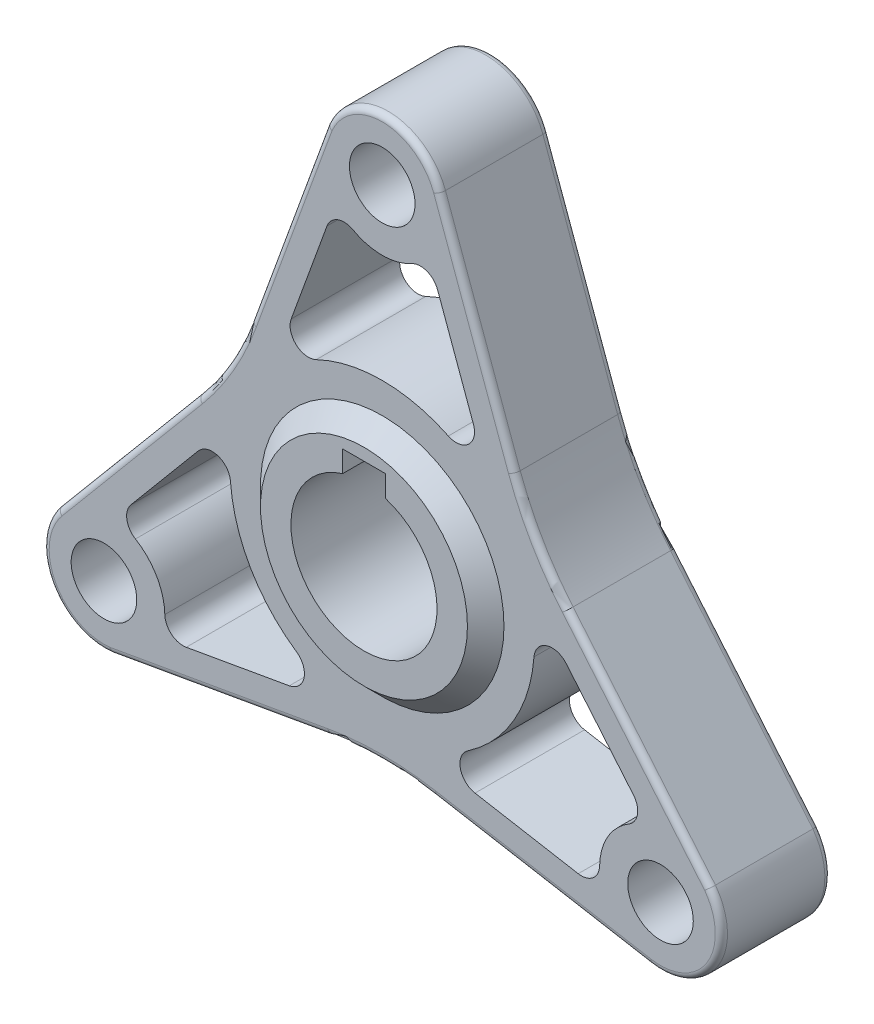
from build123d import *

# Parameters (mm, degrees)
SKETCH_1_R               = 5.386267440115599
SKETCH_1_R_2             = 5.386267440115426
SKETCH_1_R_3             = 20
SKETCH_1_R_4             = 5.3862674401151445
EXTRUDE_1_DEPTH          = 9
SKETCH_1_3_R             = 20
EXTRUDE_2_DEPTH          = 12
CUT_EXTRUDE_1_DEPTH      = 85.79389650309288
CUT_EXTRUDE_1_DEPTH_BACK = 85.79389650309288
CHAMFER_1_SIZE           = 3
FILLET_7_R               = 1
FILLET_9_R               = 1


# Some blends are built 0.0001 mm under size
with BuildPart() as part:
    # 스케치1 → 보스-돌출1 (new, symmetric)
    # profile 1 of 2: a face of its own
    with BuildSketch(Plane.XY):
        with BuildLine():
            ThreePointArc((-30.30353233995049, 7.529430557445876), (-25.30448430667716, 14.66881104177321), (-21.621123456603517, 22.56780387549022))
            Line((-21.621123456603517, 22.56780387549022), (-9.176064809943858, 56.760321490976835))
            ThreePointArc((-9.176064809943858, 56.760321490976835), (0.29852591934797246, 62.780964033722356), (9.396926207859103, 56.20562234639382))
            Line((9.396926207859103, 56.20562234639382), (21.67244430875402, 22.47891355207783))
            ThreePointArc((21.67244430875402, 22.47891355207783), (25.355805158827664, 14.579920718360814), (30.354853192101004, 7.440540234033471))
            Line((30.354853192101004, 7.440540234033471), (53.7439127431297, -20.433455513304605))
            ThreePointArc((53.7439127431297, -20.433455513304605), (54.22064676760672, -31.649013046704578), (43.97703368356183, -36.240787986690655))
            Line((43.97703368356183, -36.240787986690655), (8.631088031196274, -30.00834410952336))
            ThreePointArc((8.631088031196274, -30.00834410952336), (-0.0513208521507147, -29.248731760133694), (-8.733729735497715, -30.008344109523378))
            Line((-8.733729735497715, -30.008344109523378), (-44.56784793318583, -36.32686597767225))
            ThreePointArc((-44.56784793318583, -36.32686597767225), (-54.51917268695475, -31.131950987017753), (-53.37395989142093, -19.964834359703186))
            Line((-53.37395989142093, -19.964834359703186), (-30.30353233995049, 7.529430557445876))
        make_face()
        with Locations((-45.7135154602312, -26.392710456568583)):
            Circle(SKETCH_1_R, mode=Mode.SUBTRACT)
        with Locations((45.71351546023121, -26.392710456568555)):
            Circle(SKETCH_1_R_2, mode=Mode.SUBTRACT)
        Circle(SKETCH_1_R_3, mode=Mode.SUBTRACT)
        with Locations((0, 52.78542091313719)):
            Circle(SKETCH_1_R_4, mode=Mode.SUBTRACT)
        with BuildLine():
            ThreePointArc((-24.93099104661169, -1.856255756561672), (-27.002088749126838, 0.7762442533106575), (-30.22084330156199, -0.1506436182894203))
            Line((-30.22084330156199, -0.1506436182894203), (-41.28698133071818, -13.338753370678669))
            ThreePointArc((-41.28698133071818, -13.338753370678669), (-41.94835091243124, -15.758382440557112), (-40.54069433802355, -17.834561028237598))
            ThreePointArc((-40.54069433802355, -17.834561028237598), (-37.056732035085815, -21.386703991318203), (-35.71581818831214, -26.17811954561789))
            ThreePointArc((-35.71581818831214, -26.17811954561789), (-34.620101474352836, -28.43243494649932), (-32.19556447373562, -29.068165531369296))
            Line((-32.19556447373562, -29.068165531369296), (-15.261974751472668, -26.082316783086657))
            ThreePointArc((-15.261974751472668, -26.082316783086657), (-12.850176674158359, -23.759574441635834), (-14.091892218279895, -20.64990493218754))
            ThreePointArc((-14.091892218279895, -20.64990493218754), (-21.656330873683668, -12.49012942645256), (-24.93099104661169, -1.856255756561672))
        make_face(mode=Mode.SUBTRACT)
        with BuildLine():
            ThreePointArc((14.073060164409453, -20.662743709607216), (12.828797131654818, -23.77261693864109), (15.240882851137762, -26.096696213796697))
            Line((15.240882851137762, -26.096696213796697), (32.19518993918212, -29.086197992636468))
            ThreePointArc((32.19518993918212, -29.086197992636468), (34.6213349722887, -28.44914631675104), (35.71553008480945, -26.19199066966955))
            ThreePointArc((35.71553008480945, -26.19199066966955), (37.049794977242556, -21.39871932795785), (40.5288256439671, -17.841746095215687))
            ThreePointArc((40.5288256439671, -17.841746095215687), (41.93326169229327, -15.765669885135), (41.2715520284448, -13.34809395775018))
            Line((41.2715520284448, -13.34809395775018), (30.2189362994426, -0.1760994551487046))
            ThreePointArc((30.2189362994426, -0.1760994551487046), (27.001483386643283, 0.7512077778785407), (24.929288366147933, -1.8789841823288744))
            ThreePointArc((24.929288366147933, -1.8789841823288744), (21.644934816705337, -12.509867976144985), (14.073060164409453, -20.662743709607216))
        make_face(mode=Mode.SUBTRACT)
        with BuildLine():
            ThreePointArc((-4.813007455654948, 44.019865640833565), (-7.313160217940428, 44.19810483163431), (-9.075987554709165, 42.41625948911946))
            Line((-9.075987554709165, 42.41625948911946), (-14.95696154796992, 26.258416238235363))
            ThreePointArc((-14.95696154796992, 26.258416238235363), (-14.151306712484917, 23.008366663757286), (-10.837396147868024, 22.528889114516407))
            ThreePointArc((-10.837396147868024, 22.528889114516407), (0.01139605697825839, 24.999997402597582), (10.857930882202126, 22.51899946616905))
            ThreePointArc((10.857930882202126, 22.51899946616905), (14.17329161747192, 22.99637268533062), (14.979960450424109, 26.247339832086322))
            Line((14.979960450424109, 26.247339832086322), (9.091791391536077, 42.42495136331512))
            ThreePointArc((9.091791391536077, 42.42495136331512), (7.327015940142559, 44.20752875730815), (4.825164253214109, 44.02655169790714))
            ThreePointArc((4.825164253214109, 44.02655169790714), (0.00693705784330613, 42.785423319276056), (-4.813007455654948, 44.019865640833565))
        make_face(mode=Mode.SUBTRACT)
    # profile 2 of 2: a face of its own
    with BuildSketch(Plane.XY):
        Circle(SKETCH_1_R_3)
    extrude(amount=EXTRUDE_1_DEPTH, both=True)

    # 스케치1<3> → 보스-돌출2 (add, symmetric)
    with BuildSketch(Plane.XY):
        Circle(SKETCH_1_3_R)
    extrude(amount=EXTRUDE_2_DEPTH, both=True)

    # 스케치2 → 컷-돌출1 (cut, two sides: drawn at the far end of the back side and taken through both)
    with BuildSketch(Plane.XY.offset(-CUT_EXTRUDE_1_DEPTH_BACK)):
        with BuildLine():
            Line((-3.5000000000000018, 14.999999999999998), (3.4999999999999982, 14.999999999999998))
            Line((3.4999999999999982, 14.999999999999998), (3.4999999999999987, 11.478240283248999))
            ThreePointArc((3.4999999999999987, 11.478240283248999), (-2.2e-15, -12.000000000000004), (-3.5000000000000013, 11.478240283248999))
            Line((-3.5000000000000013, 11.478240283248999), (-3.5000000000000018, 14.999999999999998))
        make_face()
    extrude(amount=CUT_EXTRUDE_1_DEPTH + CUT_EXTRUDE_1_DEPTH_BACK, mode=Mode.SUBTRACT)

    # 모따기1
    chamfer_1_edges = [part.edges().sort_by_distance(p)[0] for p in [
        (-20, 2.45e-15, -12),
        (-20, 2.45e-15, 12),
    ]]
    chamfer(chamfer_1_edges, length=CHAMFER_1_SIZE - 0.0001)  # a hair under: the kernel refuses the full size

    # 필렛7
    # the kernel refuses this fillet: 1 mm, written as the material it takes off along each edge
    with BuildSketch(Plane(origin=(-21.621123456603517, 22.56780387549022, -9), x_dir=(0.9396926207859106, -0.34202014332566255, 0), z_dir=(0.34202014332566255, 0.9396926207859106, 0))) as fillet_7_piece_1:
        with BuildLine():
            CenterArc((FILLET_7_R, -FILLET_7_R), FILLET_7_R, 90, 90)
            Line((0, -FILLET_7_R), (-FILLET_7_R * 0.02, -FILLET_7_R))
            Line((-FILLET_7_R * 0.02, -FILLET_7_R), (-FILLET_7_R * 0.02, FILLET_7_R * 0.02))
            Line((-FILLET_7_R * 0.02, FILLET_7_R * 0.02), (FILLET_7_R, FILLET_7_R * 0.02))
            Line((FILLET_7_R, FILLET_7_R * 0.02), (FILLET_7_R, 0))
        make_face()
    extrude(amount=37.386917231391855, mode=Mode.SUBTRACT)
    with BuildSketch(Plane(origin=(8.9e-16, 52.78542091313719, -9), x_dir=(-0.952733181074785, 0.30380830416418975, 0), z_dir=(-0.30380830416418975, -0.952733181074785, 0))) as fillet_7_piece_2:
        with BuildLine():
            CenterArc((9.999999999999998 - FILLET_7_R, -FILLET_7_R), FILLET_7_R, 0, 90)
            Line((10, -FILLET_7_R), (9.999999999999998 + FILLET_7_R * 0.02, -FILLET_7_R))
            Line((9.999999999999998 + FILLET_7_R * 0.02, -FILLET_7_R), (9.999999999999998 + FILLET_7_R * 0.02, FILLET_7_R * 0.02))
            Line((9.999999999999998 + FILLET_7_R * 0.02, FILLET_7_R * 0.02), (9.999999999999998 - FILLET_7_R, FILLET_7_R * 0.02))
            Line((9.999999999999998 - FILLET_7_R, FILLET_7_R * 0.02), (9.999999999999998 - FILLET_7_R, 0))
        make_face()
    revolve(axis=Axis((8.9e-16, 52.78542091313719, -9), (0, 0, -1)), revolution_arc=142.31351700415118, mode=Mode.SUBTRACT)
    with BuildSketch(Plane(origin=(9.396926207859103, 56.20562234639382, -9), x_dir=(-0.9396926207859108, -0.3420201433256624, 0), z_dir=(0.3420201433256624, -0.9396926207859108, 0))) as fillet_7_piece_3:
        with BuildLine():
            CenterArc((FILLET_7_R, -FILLET_7_R), FILLET_7_R, 90, 90)
            Line((0, -FILLET_7_R), (-FILLET_7_R * 0.02, -FILLET_7_R))
            Line((-FILLET_7_R * 0.02, -FILLET_7_R), (-FILLET_7_R * 0.02, FILLET_7_R * 0.02))
            Line((-FILLET_7_R * 0.02, FILLET_7_R * 0.02), (FILLET_7_R, FILLET_7_R * 0.02))
            Line((FILLET_7_R, FILLET_7_R * 0.02), (FILLET_7_R, 0))
        make_face()
    extrude(amount=35.891213837678855, mode=Mode.SUBTRACT)
    with BuildSketch(Plane(origin=(68.65707534805, 39.57992071836101, -9), x_dir=(-0.9396926207859114, -0.3420201433256606, 0), z_dir=(-0.3420201433256606, 0.9396926207859114, 0))) as fillet_7_piece_4:
        with BuildLine():
            CenterArc((50.00000000000044 + FILLET_7_R, FILLET_7_R), FILLET_7_R, 180, 90)
            Line((50.00000000000044, FILLET_7_R), (50.00000000000044 - FILLET_7_R * 0.02, FILLET_7_R))
            Line((50.00000000000044 - FILLET_7_R * 0.02, FILLET_7_R), (50.00000000000044 - FILLET_7_R * 0.02, -FILLET_7_R * 0.02))
            Line((50.00000000000044 - FILLET_7_R * 0.02, -FILLET_7_R * 0.02), (50.00000000000044 + FILLET_7_R, -FILLET_7_R * 0.02))
            Line((50.00000000000044 + FILLET_7_R, -FILLET_7_R * 0.02), (50.00000000000044 + FILLET_7_R, 0))
        make_face()
    revolve(axis=Axis((68.65707534805, 39.57992071836101, -9), (0, 0, 1)), revolution_arc=20.000000000000934, mode=Mode.SUBTRACT)
    with BuildSketch(Plane(origin=(30.354853192101004, 7.440540234033471, -9), x_dir=(-0.7660444431189747, -0.6427876096865432, 0), z_dir=(0.6427876096865434, -0.7660444431189748, 0))) as fillet_7_piece_5:
        with BuildLine():
            CenterArc((FILLET_7_R, -FILLET_7_R), FILLET_7_R, 90, 90)
            Line((0, -FILLET_7_R), (-FILLET_7_R * 0.02, -FILLET_7_R))
            Line((-FILLET_7_R * 0.02, -FILLET_7_R), (-FILLET_7_R * 0.02, FILLET_7_R * 0.02))
            Line((-FILLET_7_R * 0.02, FILLET_7_R * 0.02), (FILLET_7_R, FILLET_7_R * 0.02))
            Line((FILLET_7_R, FILLET_7_R * 0.02), (FILLET_7_R, 0))
        make_face()
    extrude(amount=37.386917231392225, mode=Mode.SUBTRACT)
    with BuildSketch(Plane(origin=(45.71351546023114, -26.392710456568558, -9), x_dir=(0.7394722998242538, 0.673186985757025, 0), z_dir=(-0.673186985757025, 0.7394722998242538, 0))) as fillet_7_piece_6:
        with BuildLine():
            CenterArc((10.000000000000018 - FILLET_7_R, -FILLET_7_R), FILLET_7_R, 0, 90)
            Line((10.000000000000018, -FILLET_7_R), (10.000000000000018 + FILLET_7_R * 0.02, -FILLET_7_R))
            Line((10.000000000000018 + FILLET_7_R * 0.02, -FILLET_7_R), (10.000000000000018 + FILLET_7_R * 0.02, FILLET_7_R * 0.02))
            Line((10.000000000000018 + FILLET_7_R * 0.02, FILLET_7_R * 0.02), (10.000000000000018 - FILLET_7_R, FILLET_7_R * 0.02))
            Line((10.000000000000018 - FILLET_7_R, FILLET_7_R * 0.02), (10.000000000000018 - FILLET_7_R, 0))
        make_face()
    revolve(axis=Axis((45.71351546023114, -26.392710456568558, -9), (0, 0, -1)), revolution_arc=142.31351700415058, mode=Mode.SUBTRACT)
    with BuildSketch(Plane(origin=(43.97703368356183, -36.240787986690655, -9), x_dir=(0.17364817766693527, 0.9848077530122072, 0), z_dir=(-0.9848077530122072, 0.17364817766693527, 0))) as fillet_7_piece_7:
        with BuildLine():
            CenterArc((FILLET_7_R, -FILLET_7_R), FILLET_7_R, 90, 90)
            Line((0, -FILLET_7_R), (-FILLET_7_R * 0.02, -FILLET_7_R))
            Line((-FILLET_7_R * 0.02, -FILLET_7_R), (-FILLET_7_R * 0.02, FILLET_7_R * 0.02))
            Line((-FILLET_7_R * 0.02, FILLET_7_R * 0.02), (FILLET_7_R, FILLET_7_R * 0.02))
            Line((FILLET_7_R, FILLET_7_R * 0.02), (FILLET_7_R, 0))
        make_face()
    extrude(amount=35.89121383767927, mode=Mode.SUBTRACT)
    with BuildSketch(Plane(origin=(-0.05132085215066962, -79.24873176013405, -9), x_dir=(0.1736481776669377, 0.9848077530122067, 0), z_dir=(0.9848077530122067, -0.1736481776669377, 0))) as fillet_7_piece_8:
        with BuildLine():
            CenterArc((50.00000000000036 + FILLET_7_R, FILLET_7_R), FILLET_7_R, 180, 90)
            Line((50.00000000000036, FILLET_7_R), (50.00000000000036 - FILLET_7_R * 0.02, FILLET_7_R))
            Line((50.00000000000036 - FILLET_7_R * 0.02, FILLET_7_R), (50.00000000000036 - FILLET_7_R * 0.02, -FILLET_7_R * 0.02))
            Line((50.00000000000036 - FILLET_7_R * 0.02, -FILLET_7_R * 0.02), (50.00000000000036 + FILLET_7_R, -FILLET_7_R * 0.02))
            Line((50.00000000000036 + FILLET_7_R, -FILLET_7_R * 0.02), (50.00000000000036 + FILLET_7_R, 0))
        make_face()
    revolve(axis=Axis((-0.05132085215066962, -79.24873176013405, -9), (0, 0, 1)), revolution_arc=20.00000000000097, mode=Mode.SUBTRACT)
    with BuildSketch(Plane(origin=(-8.733729735497715, -30.008344109523378, -9), x_dir=(-0.17364817766693744, 0.9848077530122069, 0), z_dir=(-0.9848077530122069, -0.17364817766693744, 0))) as fillet_7_piece_9:
        with BuildLine():
            CenterArc((FILLET_7_R, -FILLET_7_R), FILLET_7_R, 90, 90)
            Line((0, -FILLET_7_R), (-FILLET_7_R * 0.02, -FILLET_7_R))
            Line((-FILLET_7_R * 0.02, -FILLET_7_R), (-FILLET_7_R * 0.02, FILLET_7_R * 0.02))
            Line((-FILLET_7_R * 0.02, FILLET_7_R * 0.02), (FILLET_7_R, FILLET_7_R * 0.02))
            Line((FILLET_7_R, FILLET_7_R * 0.02), (FILLET_7_R, 0))
        make_face()
    extrude(amount=37.38691723139181, mode=Mode.SUBTRACT)
    with BuildSketch(Plane(origin=(-45.713515460231235, -26.392710456568643, -9), x_dir=(0.21326088125054068, -0.9769952899212169, 0), z_dir=(0.9769952899212169, 0.21326088125054068, 0))) as fillet_7_piece_10:
        with BuildLine():
            CenterArc((9.999999999999979 - FILLET_7_R, -FILLET_7_R), FILLET_7_R, 0, 90)
            Line((9.999999999999973, -FILLET_7_R), (9.999999999999979 + FILLET_7_R * 0.02, -FILLET_7_R))
            Line((9.999999999999979 + FILLET_7_R * 0.02, -FILLET_7_R), (9.999999999999979 + FILLET_7_R * 0.02, FILLET_7_R * 0.02))
            Line((9.999999999999979 + FILLET_7_R * 0.02, FILLET_7_R * 0.02), (9.999999999999979 - FILLET_7_R, FILLET_7_R * 0.02))
            Line((9.999999999999979 - FILLET_7_R, FILLET_7_R * 0.02), (9.999999999999979 - FILLET_7_R, 0))
        make_face()
    revolve(axis=Axis((-45.713515460231235, -26.392710456568643, -9), (0, 0, -1)), revolution_arc=142.31351700415175, mode=Mode.SUBTRACT)
    with BuildSketch(Plane(origin=(-53.37395989142093, -19.964834359703186, -9), x_dir=(0.7660444431189748, -0.6427876096865431, 0), z_dir=(0.6427876096865432, 0.7660444431189749, 0))) as fillet_7_piece_11:
        with BuildLine():
            CenterArc((FILLET_7_R, -FILLET_7_R), FILLET_7_R, 90, 90)
            Line((0, -FILLET_7_R), (-FILLET_7_R * 0.02, -FILLET_7_R))
            Line((-FILLET_7_R * 0.02, -FILLET_7_R), (-FILLET_7_R * 0.02, FILLET_7_R * 0.02))
            Line((-FILLET_7_R * 0.02, FILLET_7_R * 0.02), (FILLET_7_R, FILLET_7_R * 0.02))
            Line((FILLET_7_R, FILLET_7_R * 0.02), (FILLET_7_R, 0))
        make_face()
    extrude(amount=35.89121383767928, mode=Mode.SUBTRACT)
    with BuildSketch(Plane(origin=(-68.60575449589972, 39.66881104177352, -9), x_dir=(0.766044443118974, -0.6427876096865442, 0), z_dir=(-0.6427876096865442, -0.766044443118974, 0))) as fillet_7_piece_12:
        with BuildLine():
            CenterArc((50.000000000000696 + FILLET_7_R, FILLET_7_R), FILLET_7_R, 180, 90)
            Line((50.000000000000696, FILLET_7_R), (50.000000000000696 - FILLET_7_R * 0.02, FILLET_7_R))
            Line((50.000000000000696 - FILLET_7_R * 0.02, FILLET_7_R), (50.000000000000696 - FILLET_7_R * 0.02, -FILLET_7_R * 0.02))
            Line((50.000000000000696 - FILLET_7_R * 0.02, -FILLET_7_R * 0.02), (50.000000000000696 + FILLET_7_R, -FILLET_7_R * 0.02))
            Line((50.000000000000696 + FILLET_7_R, -FILLET_7_R * 0.02), (50.000000000000696 + FILLET_7_R, 0))
        make_face()
    revolve(axis=Axis((-68.60575449589972, 39.66881104177352, -9), (0, 0, 1)), revolution_arc=20.00000000000081, mode=Mode.SUBTRACT)

    # 필렛9
    # the kernel refuses this fillet: 1 mm, written as the material it takes off along each edge
    with BuildSketch(Plane(origin=(-68.60575449589972, 39.66881104177352, 9), x_dir=(0.766044443118974, -0.6427876096865442, 0), z_dir=(-0.6427876096865442, -0.766044443118974, 0))) as fillet_9_piece_1:
        with BuildLine():
            CenterArc((50.000000000000696 + FILLET_9_R, -FILLET_9_R), FILLET_9_R, 90, 90)
            Line((50.000000000000696 + FILLET_9_R, 0), (50.000000000000696 + FILLET_9_R, FILLET_9_R * 0.02))
            Line((50.000000000000696 + FILLET_9_R, FILLET_9_R * 0.02), (50.000000000000696 - FILLET_9_R * 0.02, FILLET_9_R * 0.02))
            Line((50.000000000000696 - FILLET_9_R * 0.02, FILLET_9_R * 0.02), (50.000000000000696 - FILLET_9_R * 0.02, -FILLET_9_R))
            Line((50.000000000000696 - FILLET_9_R * 0.02, -FILLET_9_R), (50.000000000000696, -FILLET_9_R))
        make_face()
    revolve(axis=Axis((-68.60575449589972, 39.66881104177352, 9), (0, 0, 1)), revolution_arc=20.00000000000081, mode=Mode.SUBTRACT)
    with BuildSketch(Plane(origin=(-53.37395989142093, -19.964834359703186, 9), x_dir=(0, 0, -1), z_dir=(0.6427876096865432, 0.7660444431189749, 0))) as fillet_9_piece_2:
        with BuildLine():
            CenterArc((FILLET_9_R, -FILLET_9_R), FILLET_9_R, 90, 90)
            Line((0, -FILLET_9_R), (-FILLET_9_R * 0.02, -FILLET_9_R))
            Line((-FILLET_9_R * 0.02, -FILLET_9_R), (-FILLET_9_R * 0.02, FILLET_9_R * 0.02))
            Line((-FILLET_9_R * 0.02, FILLET_9_R * 0.02), (FILLET_9_R, FILLET_9_R * 0.02))
            Line((FILLET_9_R, FILLET_9_R * 0.02), (FILLET_9_R, 0))
        make_face()
    extrude(amount=35.89121383767928, mode=Mode.SUBTRACT)
    with BuildSketch(Plane(origin=(-45.713515460231235, -26.392710456568643, 9), x_dir=(0.21326088125054068, -0.9769952899212169, 0), z_dir=(0.9769952899212169, 0.21326088125054068, 0))) as fillet_9_piece_3:
        with BuildLine():
            CenterArc((9.999999999999979 - FILLET_9_R, FILLET_9_R), FILLET_9_R, 270.00000000000034, 89.99999999999966)
            Line((9.999999999999979 - FILLET_9_R, 0), (9.999999999999979 - FILLET_9_R, -FILLET_9_R * 0.02))
            Line((9.999999999999979 - FILLET_9_R, -FILLET_9_R * 0.02), (9.999999999999979 + FILLET_9_R * 0.02, -FILLET_9_R * 0.02))
            Line((9.999999999999979 + FILLET_9_R * 0.02, -FILLET_9_R * 0.02), (9.999999999999979 + FILLET_9_R * 0.02, FILLET_9_R))
            Line((9.999999999999979 + FILLET_9_R * 0.02, FILLET_9_R), (9.999999999999973, FILLET_9_R))
        make_face()
    revolve(axis=Axis((-45.713515460231235, -26.392710456568643, 9), (0, 0, -1)), revolution_arc=142.31351700415175, mode=Mode.SUBTRACT)
    with BuildSketch(Plane(origin=(-8.733729735497715, -30.008344109523378, 9), x_dir=(0, 0, -1), z_dir=(-0.9848077530122069, -0.17364817766693744, 0))) as fillet_9_piece_4:
        with BuildLine():
            CenterArc((FILLET_9_R, -FILLET_9_R), FILLET_9_R, 90, 90)
            Line((0, -FILLET_9_R), (-FILLET_9_R * 0.02, -FILLET_9_R))
            Line((-FILLET_9_R * 0.02, -FILLET_9_R), (-FILLET_9_R * 0.02, FILLET_9_R * 0.02))
            Line((-FILLET_9_R * 0.02, FILLET_9_R * 0.02), (FILLET_9_R, FILLET_9_R * 0.02))
            Line((FILLET_9_R, FILLET_9_R * 0.02), (FILLET_9_R, 0))
        make_face()
    extrude(amount=37.38691723139181, mode=Mode.SUBTRACT)
    with BuildSketch(Plane(origin=(-0.05132085215066962, -79.24873176013405, 9), x_dir=(0.1736481776669377, 0.9848077530122067, 0), z_dir=(0.9848077530122067, -0.1736481776669377, 0))) as fillet_9_piece_5:
        with BuildLine():
            CenterArc((50.00000000000036 + FILLET_9_R, -FILLET_9_R), FILLET_9_R, 90, 90)
            Line((50.00000000000036 + FILLET_9_R, 0), (50.00000000000036 + FILLET_9_R, FILLET_9_R * 0.02))
            Line((50.00000000000036 + FILLET_9_R, FILLET_9_R * 0.02), (50.00000000000036 - FILLET_9_R * 0.02, FILLET_9_R * 0.02))
            Line((50.00000000000036 - FILLET_9_R * 0.02, FILLET_9_R * 0.02), (50.00000000000036 - FILLET_9_R * 0.02, -FILLET_9_R))
            Line((50.00000000000036 - FILLET_9_R * 0.02, -FILLET_9_R), (50.00000000000036, -FILLET_9_R))
        make_face()
    revolve(axis=Axis((-0.05132085215066962, -79.24873176013405, 9), (0, 0, 1)), revolution_arc=20.00000000000097, mode=Mode.SUBTRACT)
    with BuildSketch(Plane(origin=(43.97703368356183, -36.240787986690655, 9), x_dir=(0, 0, -1), z_dir=(-0.9848077530122072, 0.17364817766693527, 0))) as fillet_9_piece_6:
        with BuildLine():
            CenterArc((FILLET_9_R, -FILLET_9_R), FILLET_9_R, 90, 90)
            Line((0, -FILLET_9_R), (-FILLET_9_R * 0.02, -FILLET_9_R))
            Line((-FILLET_9_R * 0.02, -FILLET_9_R), (-FILLET_9_R * 0.02, FILLET_9_R * 0.02))
            Line((-FILLET_9_R * 0.02, FILLET_9_R * 0.02), (FILLET_9_R, FILLET_9_R * 0.02))
            Line((FILLET_9_R, FILLET_9_R * 0.02), (FILLET_9_R, 0))
        make_face()
    extrude(amount=35.89121383767927, mode=Mode.SUBTRACT)
    with BuildSketch(Plane(origin=(45.71351546023114, -26.392710456568558, 9), x_dir=(0.7394722998242538, 0.673186985757025, 0), z_dir=(-0.673186985757025, 0.7394722998242538, 0))) as fillet_9_piece_7:
        with BuildLine():
            CenterArc((10.000000000000016 - FILLET_9_R, FILLET_9_R), FILLET_9_R, 269.9999999999998, 90.00000000000023)
            Line((10.000000000000016 - FILLET_9_R, 0), (10.000000000000016 - FILLET_9_R, -FILLET_9_R * 0.02))
            Line((10.000000000000016 - FILLET_9_R, -FILLET_9_R * 0.02), (10.000000000000016 + FILLET_9_R * 0.02, -FILLET_9_R * 0.02))
            Line((10.000000000000016 + FILLET_9_R * 0.02, -FILLET_9_R * 0.02), (10.000000000000016 + FILLET_9_R * 0.02, FILLET_9_R))
            Line((10.000000000000016 + FILLET_9_R * 0.02, FILLET_9_R), (10.000000000000018, FILLET_9_R))
        make_face()
    revolve(axis=Axis((45.71351546023114, -26.392710456568558, 9), (0, 0, -1)), revolution_arc=142.31351700415058, mode=Mode.SUBTRACT)
    with BuildSketch(Plane(origin=(30.354853192101004, 7.440540234033471, 9), x_dir=(0, 0, -1), z_dir=(0.6427876096865434, -0.7660444431189748, 0))) as fillet_9_piece_8:
        with BuildLine():
            CenterArc((FILLET_9_R, -FILLET_9_R), FILLET_9_R, 90, 90)
            Line((0, -FILLET_9_R), (-FILLET_9_R * 0.02, -FILLET_9_R))
            Line((-FILLET_9_R * 0.02, -FILLET_9_R), (-FILLET_9_R * 0.02, FILLET_9_R * 0.02))
            Line((-FILLET_9_R * 0.02, FILLET_9_R * 0.02), (FILLET_9_R, FILLET_9_R * 0.02))
            Line((FILLET_9_R, FILLET_9_R * 0.02), (FILLET_9_R, 0))
        make_face()
    extrude(amount=37.386917231392225, mode=Mode.SUBTRACT)
    with BuildSketch(Plane(origin=(68.65707534805, 39.57992071836101, 9), x_dir=(-0.9396926207859114, -0.3420201433256606, 0), z_dir=(-0.3420201433256606, 0.9396926207859114, 0))) as fillet_9_piece_9:
        with BuildLine():
            CenterArc((50.00000000000044 + FILLET_9_R, -FILLET_9_R), FILLET_9_R, 90, 90)
            Line((50.00000000000044 + FILLET_9_R, 0), (50.00000000000044 + FILLET_9_R, FILLET_9_R * 0.02))
            Line((50.00000000000044 + FILLET_9_R, FILLET_9_R * 0.02), (50.00000000000044 - FILLET_9_R * 0.02, FILLET_9_R * 0.02))
            Line((50.00000000000044 - FILLET_9_R * 0.02, FILLET_9_R * 0.02), (50.00000000000044 - FILLET_9_R * 0.02, -FILLET_9_R))
            Line((50.00000000000044 - FILLET_9_R * 0.02, -FILLET_9_R), (50.00000000000044, -FILLET_9_R))
        make_face()
    revolve(axis=Axis((68.65707534805, 39.57992071836101, 9), (0, 0, 1)), revolution_arc=20.000000000000934, mode=Mode.SUBTRACT)
    with BuildSketch(Plane(origin=(9.396926207859103, 56.20562234639382, 9), x_dir=(0, 0, -1), z_dir=(0.3420201433256624, -0.9396926207859108, 0))) as fillet_9_piece_10:
        with BuildLine():
            CenterArc((FILLET_9_R, -FILLET_9_R), FILLET_9_R, 90, 90)
            Line((0, -FILLET_9_R), (-FILLET_9_R * 0.02, -FILLET_9_R))
            Line((-FILLET_9_R * 0.02, -FILLET_9_R), (-FILLET_9_R * 0.02, FILLET_9_R * 0.02))
            Line((-FILLET_9_R * 0.02, FILLET_9_R * 0.02), (FILLET_9_R, FILLET_9_R * 0.02))
            Line((FILLET_9_R, FILLET_9_R * 0.02), (FILLET_9_R, 0))
        make_face()
    extrude(amount=35.891213837678855, mode=Mode.SUBTRACT)
    with BuildSketch(Plane(origin=(8.9e-16, 52.78542091313719, 9), x_dir=(-0.952733181074785, 0.30380830416418975, 0), z_dir=(-0.30380830416418975, -0.952733181074785, 0))) as fillet_9_piece_11:
        with BuildLine():
            CenterArc((9.999999999999998 - FILLET_9_R, FILLET_9_R), FILLET_9_R, 270, 90)
            Line((9.999999999999998 - FILLET_9_R, 0), (9.999999999999998 - FILLET_9_R, -FILLET_9_R * 0.02))
            Line((9.999999999999998 - FILLET_9_R, -FILLET_9_R * 0.02), (9.999999999999998 + FILLET_9_R * 0.02, -FILLET_9_R * 0.02))
            Line((9.999999999999998 + FILLET_9_R * 0.02, -FILLET_9_R * 0.02), (9.999999999999998 + FILLET_9_R * 0.02, FILLET_9_R))
            Line((9.999999999999998 + FILLET_9_R * 0.02, FILLET_9_R), (10, FILLET_9_R))
        make_face()
    revolve(axis=Axis((8.9e-16, 52.78542091313719, 9), (0, 0, -1)), revolution_arc=142.31351700415118, mode=Mode.SUBTRACT)
    with BuildSketch(Plane(origin=(-21.621123456603517, 22.56780387549022, 9), x_dir=(0, 0, -1), z_dir=(0.34202014332566255, 0.9396926207859106, 0))) as fillet_9_piece_12:
        with BuildLine():
            CenterArc((FILLET_9_R, -FILLET_9_R), FILLET_9_R, 90, 90)
            Line((0, -FILLET_9_R), (-FILLET_9_R * 0.02, -FILLET_9_R))
            Line((-FILLET_9_R * 0.02, -FILLET_9_R), (-FILLET_9_R * 0.02, FILLET_9_R * 0.02))
            Line((-FILLET_9_R * 0.02, FILLET_9_R * 0.02), (FILLET_9_R, FILLET_9_R * 0.02))
            Line((FILLET_9_R, FILLET_9_R * 0.02), (FILLET_9_R, 0))
        make_face()
    extrude(amount=37.386917231391855, mode=Mode.SUBTRACT)


solid = part.part
